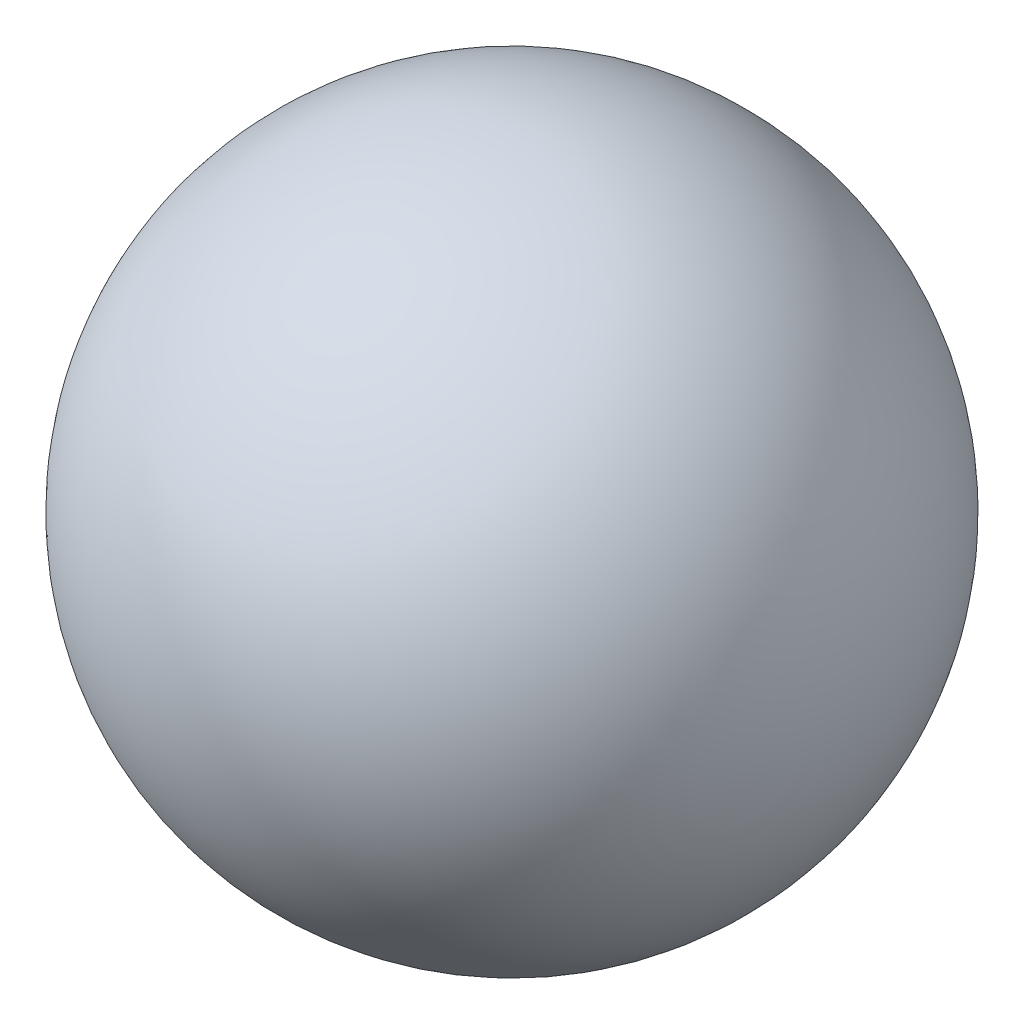
from build123d import *


with BuildPart() as part:
    # Sketch1 → Revolve1 (revolve)
    with BuildSketch(Plane.XY):
        with BuildLine():
            Line((21, 0), (-21, 0))
            ThreePointArc((-21, 0), (0, -21), (21, 0))
        make_face()
    revolve(axis=Axis((-21, 0, 0), (1, 0, 0)))


solid = part.part
